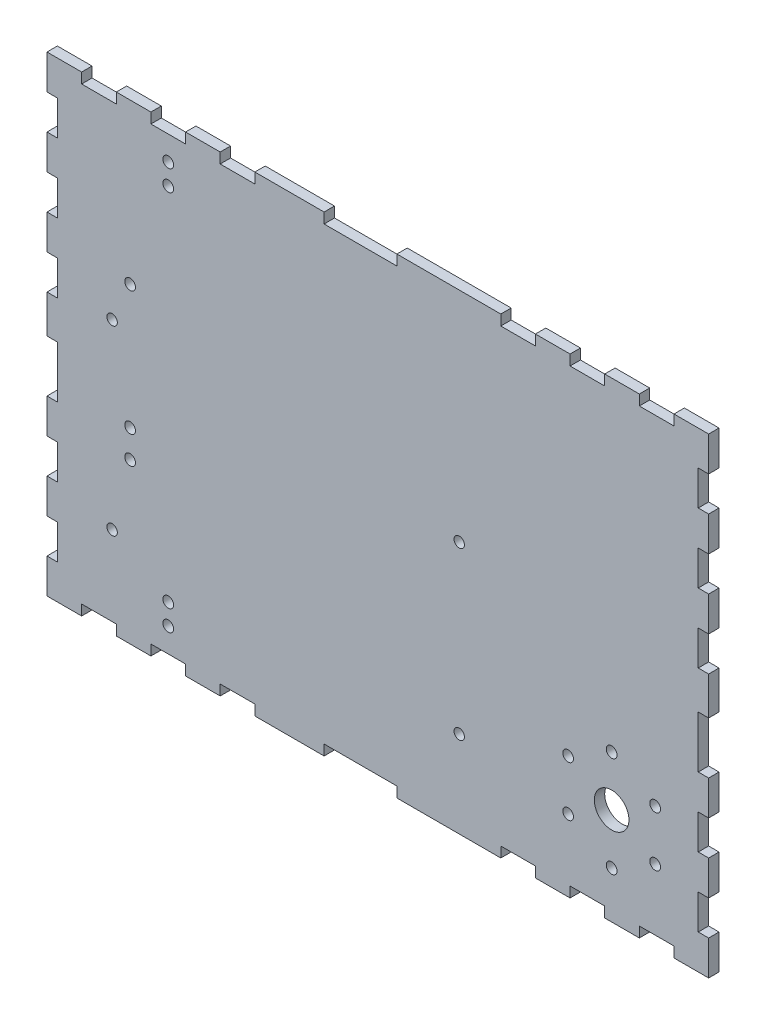
from build123d import *

# Parameters (mm, degrees)
SKETCH2_W           = 191
SKETCH2_H           = 136
SKETCH2_R           = 1.55
SKETCH2_R_2         = 1.549999948
SKETCH2_R_3         = 1.5
BOSS_EXTRUDE1_DEPTH = 3
CUT_EXTRUDE1_REACH  = 236.491
SKETCH3_W           = 10
SKETCH3_H           = 3
SKETCH3_W_2         = 21
CUT_EXTRUDE2_REACH  = 236.491
SKETCH4_W           = 3
SKETCH4_H           = 10
SKETCH4_H_2         = 15
CUT_EXTRUDE3_REACH  = 236.491
SKETCH8_R           = 5


with BuildPart() as part:
    # Sketch2 → Boss-Extrude1 (new body)
    with BuildSketch(Plane.XY):
        with Locations((95.5, 68)):
            Rectangle(SKETCH2_W, SKETCH2_H)
        with Locations((35, 16)):
            Circle(SKETCH2_R, mode=Mode.SUBTRACT)
        with Locations((35, 10)):
            Circle(SKETCH2_R, mode=Mode.SUBTRACT)
        with Locations((24, 46.069195574)):
            Circle(SKETCH2_R, mode=Mode.SUBTRACT)
        with Locations((24, 54.069195574)):
            Circle(SKETCH2_R, mode=Mode.SUBTRACT)
        with Locations((24, 89.930804426)):
            Circle(SKETCH2_R, mode=Mode.SUBTRACT)
        with Locations((35, 120)):
            Circle(SKETCH2_R, mode=Mode.SUBTRACT)
        with Locations((35, 126)):
            Circle(SKETCH2_R, mode=Mode.SUBTRACT)
        with Locations((175.557368355, 35.25)):
            Circle(SKETCH2_R_2, mode=Mode.SUBTRACT)
        with Locations((163, 42.5)):
            Circle(SKETCH2_R_2, mode=Mode.SUBTRACT)
        with Locations((150.442631645, 35.25)):
            Circle(SKETCH2_R_2, mode=Mode.SUBTRACT)
        with Locations((150.442631645, 20.75)):
            Circle(SKETCH2_R_2, mode=Mode.SUBTRACT)
        with Locations((163, 13.5)):
            Circle(SKETCH2_R_2, mode=Mode.SUBTRACT)
        with Locations((175.557368355, 20.75)):
            Circle(SKETCH2_R_2, mode=Mode.SUBTRACT)
        with Locations((18.8, 78.5)):
            Circle(SKETCH2_R_3, mode=Mode.SUBTRACT)
        with Locations((18.8, 26)):
            Circle(SKETCH2_R_3, mode=Mode.SUBTRACT)
        with Locations((119, 73)):
            Circle(SKETCH2_R_3, mode=Mode.SUBTRACT)
        with Locations((119, 25)):
            Circle(SKETCH2_R_3, mode=Mode.SUBTRACT)
    extrude(amount=BOSS_EXTRUDE1_DEPTH)

    # Sketch3 → Cut-Extrude1 (cut, up to next)
    with BuildSketch(Plane.XY.offset(3), mode=Mode.PRIVATE) as cut_extrude1_sk1:
        with Locations((176, 1.5)):
            Rectangle(SKETCH3_W, SKETCH3_H)
    cut_extrude1_tool1 = extrude(cut_extrude1_sk1.sketch, amount=-CUT_EXTRUDE1_REACH, mode=Mode.PRIVATE) & part.part
    # Sketch3 → Cut-Extrude1 (cut, up to next)
    with BuildSketch(Plane.XY.offset(3), mode=Mode.PRIVATE) as cut_extrude1_sk2:
        with Locations((156, 1.5)):
            Rectangle(SKETCH3_W, SKETCH3_H)
    cut_extrude1_tool2 = extrude(cut_extrude1_sk2.sketch, amount=-CUT_EXTRUDE1_REACH, mode=Mode.PRIVATE) & part.part
    # Sketch3 → Cut-Extrude1 (cut, up to next)
    with BuildSketch(Plane.XY.offset(3), mode=Mode.PRIVATE) as cut_extrude1_sk3:
        with Locations((136, 1.5)):
            Rectangle(SKETCH3_W, SKETCH3_H)
    cut_extrude1_tool3 = extrude(cut_extrude1_sk3.sketch, amount=-CUT_EXTRUDE1_REACH, mode=Mode.PRIVATE) & part.part
    # Sketch3 → Cut-Extrude1 (cut, up to next)
    with BuildSketch(Plane.XY.offset(3), mode=Mode.PRIVATE) as cut_extrude1_sk4:
        with Locations((90.5, 1.5)):
            Rectangle(SKETCH3_W_2, SKETCH3_H)
    cut_extrude1_tool4 = extrude(cut_extrude1_sk4.sketch, amount=-CUT_EXTRUDE1_REACH, mode=Mode.PRIVATE) & part.part
    # Sketch3 → Cut-Extrude1 (cut, up to next)
    with BuildSketch(Plane.XY.offset(3), mode=Mode.PRIVATE) as cut_extrude1_sk5:
        with Locations((55, 1.5)):
            Rectangle(SKETCH3_W, SKETCH3_H)
    cut_extrude1_tool5 = extrude(cut_extrude1_sk5.sketch, amount=-CUT_EXTRUDE1_REACH, mode=Mode.PRIVATE) & part.part
    # Sketch3 → Cut-Extrude1 (cut, up to next)
    with BuildSketch(Plane.XY.offset(3), mode=Mode.PRIVATE) as cut_extrude1_sk6:
        with Locations((35, 1.5)):
            Rectangle(SKETCH3_W, SKETCH3_H)
    cut_extrude1_tool6 = extrude(cut_extrude1_sk6.sketch, amount=-CUT_EXTRUDE1_REACH, mode=Mode.PRIVATE) & part.part
    # Sketch3 → Cut-Extrude1 (cut, up to next)
    with BuildSketch(Plane.XY.offset(3), mode=Mode.PRIVATE) as cut_extrude1_sk7:
        with Locations((15, 1.5)):
            Rectangle(SKETCH3_W, SKETCH3_H)
    cut_extrude1_tool7 = extrude(cut_extrude1_sk7.sketch, amount=-CUT_EXTRUDE1_REACH, mode=Mode.PRIVATE) & part.part
    cut_extrude1_1 = cut_extrude1_tool1.solids().sort_by_distance((176, 1.5, 3))[0]
    add(cut_extrude1_1, mode=Mode.SUBTRACT)
    cut_extrude1_2 = cut_extrude1_tool2.solids().sort_by_distance((156, 1.5, 3))[0]
    add(cut_extrude1_2, mode=Mode.SUBTRACT)
    cut_extrude1_3 = cut_extrude1_tool3.solids().sort_by_distance((136, 1.5, 3))[0]
    add(cut_extrude1_3, mode=Mode.SUBTRACT)
    cut_extrude1_4 = cut_extrude1_tool4.solids().sort_by_distance((90.5, 1.5, 3))[0]
    add(cut_extrude1_4, mode=Mode.SUBTRACT)
    cut_extrude1_5 = cut_extrude1_tool5.solids().sort_by_distance((55, 1.5, 3))[0]
    add(cut_extrude1_5, mode=Mode.SUBTRACT)
    cut_extrude1_6 = cut_extrude1_tool6.solids().sort_by_distance((35, 1.5, 3))[0]
    add(cut_extrude1_6, mode=Mode.SUBTRACT)
    cut_extrude1_7 = cut_extrude1_tool7.solids().sort_by_distance((15, 1.5, 3))[0]
    add(cut_extrude1_7, mode=Mode.SUBTRACT)
    cut_extrude1 = cut_extrude1_1 + cut_extrude1_2 + cut_extrude1_3 + cut_extrude1_4 + cut_extrude1_5 + cut_extrude1_6 + cut_extrude1_7  # Cut-Extrude1 as one shape, for the pattern or mirror that repeats it

    # Mirror1: Cut-Extrude1 across plane
    add(cut_extrude1.mirror(Plane.ZX.offset(68)), mode=Mode.SUBTRACT)

    # Sketch4 → Cut-Extrude2 (cut, up to next)
    with BuildSketch(Plane.XY.offset(3), mode=Mode.PRIVATE) as cut_extrude2_sk1:
        with Locations((1.5, 121)):
            Rectangle(SKETCH4_W, SKETCH4_H)
    cut_extrude2_tool1 = extrude(cut_extrude2_sk1.sketch, amount=-CUT_EXTRUDE2_REACH, mode=Mode.PRIVATE) & part.part
    # Sketch4 → Cut-Extrude2 (cut, up to next)
    with BuildSketch(Plane.XY.offset(3), mode=Mode.PRIVATE) as cut_extrude2_sk2:
        with Locations((1.5, 101)):
            Rectangle(SKETCH4_W, SKETCH4_H)
    cut_extrude2_tool2 = extrude(cut_extrude2_sk2.sketch, amount=-CUT_EXTRUDE2_REACH, mode=Mode.PRIVATE) & part.part
    # Sketch4 → Cut-Extrude2 (cut, up to next)
    with BuildSketch(Plane.XY.offset(3), mode=Mode.PRIVATE) as cut_extrude2_sk3:
        with Locations((1.5, 81)):
            Rectangle(SKETCH4_W, SKETCH4_H)
    cut_extrude2_tool3 = extrude(cut_extrude2_sk3.sketch, amount=-CUT_EXTRUDE2_REACH, mode=Mode.PRIVATE) & part.part
    # Sketch4 → Cut-Extrude2 (cut, up to next)
    with BuildSketch(Plane.XY.offset(3), mode=Mode.PRIVATE) as cut_extrude2_sk4:
        with Locations((1.5, 15)):
            Rectangle(SKETCH4_W, SKETCH4_H)
    cut_extrude2_tool4 = extrude(cut_extrude2_sk4.sketch, amount=-CUT_EXTRUDE2_REACH, mode=Mode.PRIVATE) & part.part
    # Sketch4 → Cut-Extrude2 (cut, up to next)
    with BuildSketch(Plane.XY.offset(3), mode=Mode.PRIVATE) as cut_extrude2_sk5:
        with Locations((1.5, 35)):
            Rectangle(SKETCH4_W, SKETCH4_H)
    cut_extrude2_tool5 = extrude(cut_extrude2_sk5.sketch, amount=-CUT_EXTRUDE2_REACH, mode=Mode.PRIVATE) & part.part
    # Sketch4 → Cut-Extrude2 (cut, up to next)
    with BuildSketch(Plane.XY.offset(3), mode=Mode.PRIVATE) as cut_extrude2_sk6:
        with Locations((1.5, 57.5)):
            Rectangle(SKETCH4_W, SKETCH4_H_2)
    cut_extrude2_tool6 = extrude(cut_extrude2_sk6.sketch, amount=-CUT_EXTRUDE2_REACH, mode=Mode.PRIVATE) & part.part
    cut_extrude2_1 = cut_extrude2_tool1.solids().sort_by_distance((1.5, 121, 3))[0]
    add(cut_extrude2_1, mode=Mode.SUBTRACT)
    cut_extrude2_2 = cut_extrude2_tool2.solids().sort_by_distance((1.5, 101, 3))[0]
    add(cut_extrude2_2, mode=Mode.SUBTRACT)
    cut_extrude2_3 = cut_extrude2_tool3.solids().sort_by_distance((1.5, 81, 3))[0]
    add(cut_extrude2_3, mode=Mode.SUBTRACT)
    cut_extrude2_4 = cut_extrude2_tool4.solids().sort_by_distance((1.5, 15, 3))[0]
    add(cut_extrude2_4, mode=Mode.SUBTRACT)
    cut_extrude2_5 = cut_extrude2_tool5.solids().sort_by_distance((1.5, 35, 3))[0]
    add(cut_extrude2_5, mode=Mode.SUBTRACT)
    cut_extrude2_6 = cut_extrude2_tool6.solids().sort_by_distance((1.5, 57.5, 3))[0]
    add(cut_extrude2_6, mode=Mode.SUBTRACT)
    cut_extrude2 = cut_extrude2_1 + cut_extrude2_2 + cut_extrude2_3 + cut_extrude2_4 + cut_extrude2_5 + cut_extrude2_6  # Cut-Extrude2 as one shape, for the pattern or mirror that repeats it

    # Mirror2: Cut-Extrude2 across plane
    add(cut_extrude2.mirror(Plane(origin=(95.5, 0, 0), x_dir=(0, 0, 1), z_dir=(1, 0, 0))), mode=Mode.SUBTRACT)

    # Sketch8 → Cut-Extrude3 (cut, up to next)
    with BuildSketch(Plane(origin=(0, 0, 0), x_dir=(-1, 0, 0), z_dir=(0, 0, -1)), mode=Mode.PRIVATE) as cut_extrude3_sk1:
        with Locations((-163, 28)):
            Circle(SKETCH8_R)
    cut_extrude3_tool1 = extrude(cut_extrude3_sk1.sketch, amount=-CUT_EXTRUDE3_REACH, mode=Mode.PRIVATE) & part.part
    add(cut_extrude3_tool1.solids().sort_by_distance((163, 28, 0))[0], mode=Mode.SUBTRACT)


solid = part.part
